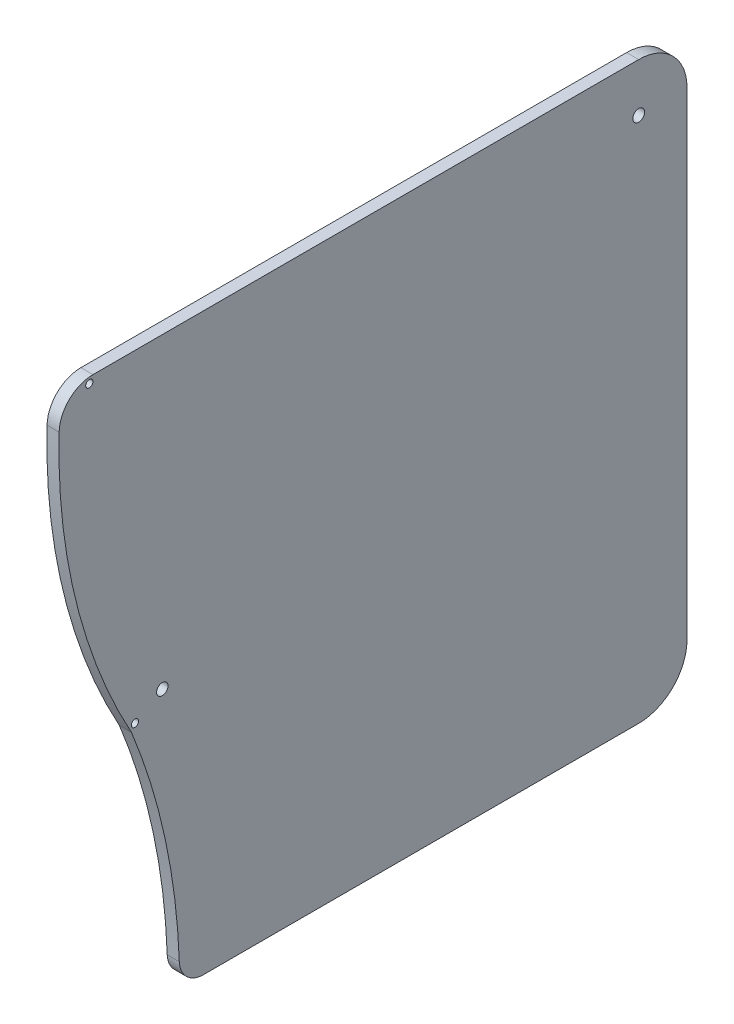
from build123d import *

# Parameters (mm, degrees)
SKETCH1_R           = 1.55
BOSS_EXTRUDE1_DEPTH = 3.175
CUT_EXTRUDE1_DEPTH  = 112.958261642
FILLET1_R           = 8.89
SKETCH3_R           = 1.5
CUT_EXTRUDE2_DEPTH  = 112.958261642
SKETCH4_R           = 0.9525
CUT_EXTRUDE3_DEPTH  = 112.958261642
FILLET2_R           = 6.35


with BuildPart() as part:
    # Sketch1 → Boss-Extrude1 (new body)
    with BuildSketch(Plane(origin=(0, 0, 0), x_dir=(0, 0, -1), z_dir=(1, 0, 0))):
        with BuildLine():
            Line((69.85, 75.565), (-82.55, 75.565))
            Line((-82.55, 75.565), (-82.55, -75.565))
            Line((-82.55, -75.565), (69.85, -75.565))
            ThreePointArc((69.85, -75.565), (78.830256121, -71.845256121), (82.55, -62.865))
            Line((82.55, -62.865), (82.55, 62.865))
            ThreePointArc((82.55, 62.865), (78.830256121, 71.845256121), (69.85, 75.565))
        make_face()
        with Locations((69.85, 62.865)):
            Circle(SKETCH1_R, mode=Mode.SUBTRACT)
    extrude(amount=BOSS_EXTRUDE1_DEPTH)

    # Sketch2 → Cut-Extrude1 (cut, through all)
    with BuildSketch(Plane(origin=(3.175, 0, 0), x_dir=(0, 0, -1), z_dir=(1, 0, 0))):
        with BuildLine():
            ThreePointArc((-50.8, -75.565), (-54.005053677, -42.622362446), (-63.5, -10.915332745))
            ThreePointArc((-63.5, -10.915332745), (-77.710665491, 24.765), (-82.55, 62.865))
            Line((-82.55, 62.865), (-82.55, -75.565))
            Line((-82.55, -75.565), (-50.8, -75.565))
        make_face()
        with BuildLine():
            Line((-82.55, 75.565), (-82.55, 62.865))
            ThreePointArc((-82.55, 62.865), (-82.417420191, 69.220528969), (-82.019911437, 75.565))
            Line((-82.019911437, 75.565), (-82.55, 75.565))
        make_face()
    extrude(amount=-CUT_EXTRUDE1_DEPTH, mode=Mode.SUBTRACT)

    # Fillet1
    fillet1_edges = [part.edges().sort_by_distance(p)[0] for p in [
        (1.5875, 75.565, 82.019911437),
    ]]
    fillet(fillet1_edges, radius=FILLET1_R)

    # Sketch3 → Cut-Extrude2 (cut, through all)
    with BuildSketch(Plane(origin=(3.175, 0, 0), x_dir=(0, 0, -1), z_dir=(1, 0, 0))):
        with Locations((-55.378790619, -5.135)):
            Circle(SKETCH3_R)
    extrude(amount=-CUT_EXTRUDE2_DEPTH, mode=Mode.SUBTRACT)

    # Sketch4 → Cut-Extrude3 (cut, through all)
    with BuildSketch(Plane(origin=(3.175, 0, 0), x_dir=(0, 0, -1), z_dir=(1, 0, 0))):
        with Locations((-74.561915864, 73.9775)):
            Circle(SKETCH4_R)
        with Locations((-62.57206458, -9.313350112)):
            Circle(SKETCH4_R)
    extrude(amount=-CUT_EXTRUDE3_DEPTH, mode=Mode.SUBTRACT)

    # Fillet2
    fillet2_edges = [part.edges().sort_by_distance(p)[0] for p in [
        (1.5875, -75.565, 50.8),
    ]]
    fillet(fillet2_edges, radius=FILLET2_R)


solid = part.part
